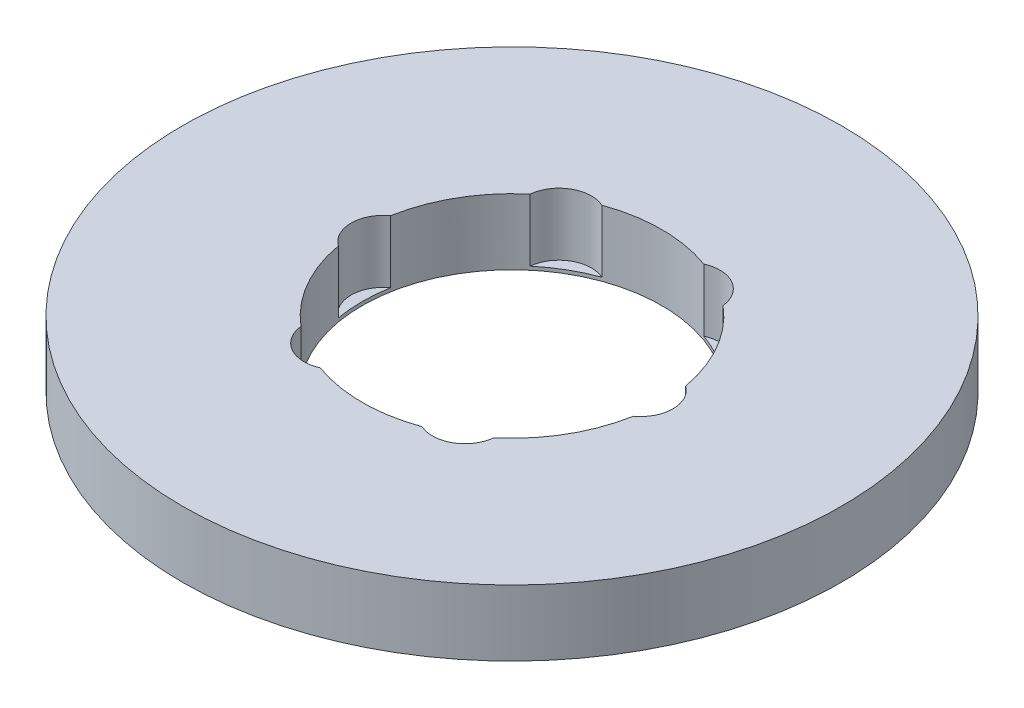
from build123d import *

# Parameters (mm, degrees)
SKETCH1_R           = 55
BOSS_EXTRUDE1_DEPTH = 11
SKETCH2_R           = 25
CUT_EXTRUDE1_DEPTH  = 79.555712714
SKETCH3_R           = 5.387585708
CUT_EXTRUDE2_DEPTH  = 10.412690586
CIRPATTERN1_COUNT   = 6


with BuildPart() as part:
    # Sketch1 → Boss-Extrude1 (new body)
    with BuildSketch(Plane(origin=(0, 0, 0), x_dir=(1, 0, 0), z_dir=(0, 1, 0))):
        Circle(SKETCH1_R)
    extrude(amount=BOSS_EXTRUDE1_DEPTH)

    # Sketch2 → Cut-Extrude1 (cut, through all)
    with BuildSketch(Plane(origin=(0, 0, 0), x_dir=(1, 0, 0), z_dir=(0, 1, 0))):
        Circle(SKETCH2_R)
    extrude(amount=CUT_EXTRUDE1_DEPTH, mode=Mode.SUBTRACT)

    # Sketch3 → Cut-Extrude2 (cut)
    with BuildSketch(Plane(origin=(0, 11, 0), x_dir=(1, 0, 0), z_dir=(0, 1, 0))):
        with Locations((-21.468113701, 0)):
            Circle(SKETCH3_R)
    cut_extrude2 = extrude(amount=-CUT_EXTRUDE2_DEPTH, mode=Mode.SUBTRACT)

    # CirPattern1: Cut-Extrude2 ×6 about axis
    cirpattern1_axis = Axis((0, 0, 0), (0, 1, 0))
    for i in range(1, CIRPATTERN1_COUNT):
        add(cut_extrude2.rotate(cirpattern1_axis, i * 360 / CIRPATTERN1_COUNT), mode=Mode.SUBTRACT)


solid = part.part
